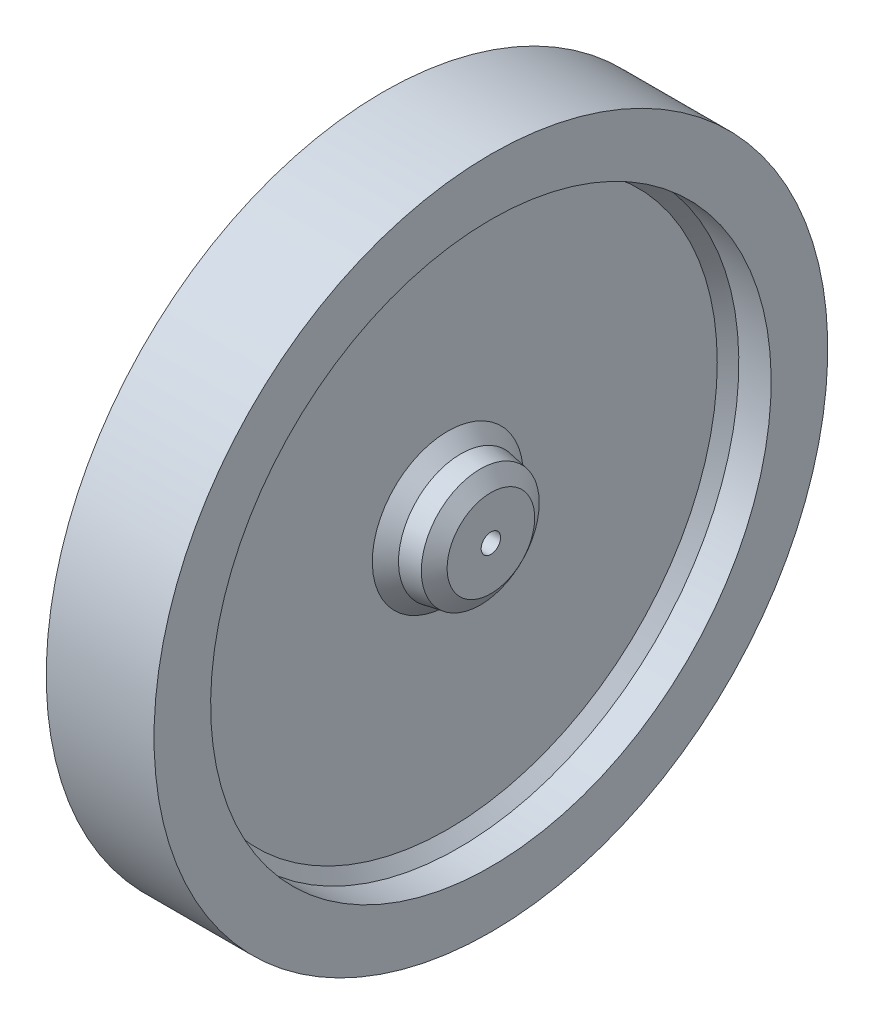
from build123d import *

# Parameters (mm, degrees)
SKETCH1_W           = 10
SKETCH1_H           = 31.25
SKETCH2_R           = 26
CUT_EXTRUDE1_DEPTH  = 4
SKETCH3_R           = 6
BOSS_EXTRUDE1_DEPTH = 4
BOSS_EXTRUDE1_TAPER = 10
CUT_EXTRUDE2_START  = -4
SKETCH4_R           = 26
CUT_EXTRUDE2_DEPTH  = 4
SKETCH5_R           = 6
BOSS_EXTRUDE2_DEPTH = 4
BOSS_EXTRUDE2_TAPER = 10
CHAMFER1_SIZE       = 1
CHAMFER1_SIZE_2     = 1.232803052
SKETCH6_R           = 0.9
CUT_EXTRUDE3_DEPTH  = 46.311422401


with BuildPart() as part:
    # Sketch1 → Revolve1 (revolve)
    with BuildSketch(Plane.XY):
        with Locations((0, -15.625)):
            Rectangle(SKETCH1_W, SKETCH1_H)
    revolve(axis=Axis((-5, 0, 0), (1, 0, 0)))

    # Sketch2 → Cut-Extrude1 (cut)
    with BuildSketch(Plane(origin=(5, 0, 0), x_dir=(0, 0, -1), z_dir=(1, 0, 0))):
        with Locations(Location((0, 0, 0), (0, 0, 90))):
            Circle(SKETCH2_R)
    extrude(amount=-CUT_EXTRUDE1_DEPTH, mode=Mode.SUBTRACT)

    # Sketch3 → Boss-Extrude1 (add)
    with BuildSketch(Plane(origin=(1, 0, 0), x_dir=(0, 0, -1), z_dir=(1, 0, 0))):
        Circle(SKETCH3_R)
    extrude(amount=BOSS_EXTRUDE1_DEPTH, taper=BOSS_EXTRUDE1_TAPER)

    # Sketch4 → Cut-Extrude2 (cut)
    with BuildSketch(Plane.ZY.offset(5).offset(CUT_EXTRUDE2_START)):
        with Locations(Location((0, 0, 0), (0, 0, 90))):
            Circle(SKETCH4_R)
    extrude(amount=CUT_EXTRUDE2_DEPTH, mode=Mode.SUBTRACT)

    # Sketch5 → Boss-Extrude2 (add)
    with BuildSketch(Plane.ZY.offset(1)):
        Circle(SKETCH5_R)
    extrude(amount=BOSS_EXTRUDE2_DEPTH, taper=BOSS_EXTRUDE2_TAPER)

    # Chamfer1
    # the kernel refuses this chamfer: 1.232803052, 1 mm, written as the material it adds along each edge
    with BuildSketch(Plane(origin=(1, 0, 0), x_dir=(0, 0, -1), z_dir=(0, -1, 0))) as chamfer1_piece_1:
        Polygon((6 + CHAMFER1_SIZE, 0), (6 - CHAMFER1_SIZE_2 * 0.173648177642, CHAMFER1_SIZE_2 * 0.98480775287), (6, 0), align=None)
    revolve(axis=Axis((1, 0, 0), (1, 0, 0)))
    with BuildSketch(Plane(origin=(-1, 0, 0), x_dir=(0, 1, 0), z_dir=(0, 0, 1))) as chamfer1_piece_2:
        Polygon((26, CHAMFER1_SIZE), (26 - CHAMFER1_SIZE, 0), (26, 0), align=None)
    revolve(axis=Axis((-1, 0, 0), (-1, 0, 0)))
    with BuildSketch(Plane(origin=(1, 0, 0), x_dir=(0, 1, 0), z_dir=(0, 0, -1))) as chamfer1_piece_3:
        Polygon((26, CHAMFER1_SIZE), (26 - CHAMFER1_SIZE, 0), (26, 0), align=None)
    revolve(axis=Axis((1, 0, 0), (1, 0, 0)))
    with BuildSketch(Plane(origin=(-1, 0, 0), x_dir=(0, 0, 1), z_dir=(0, -1, 0))) as chamfer1_piece_4:
        Polygon((6 + CHAMFER1_SIZE, 0), (6 - CHAMFER1_SIZE_2 * 0.173648177642, CHAMFER1_SIZE_2 * 0.98480775287), (6, 0), align=None)
    revolve(axis=Axis((-1, 0, 0), (-1, 0, 0)))
    # the kernel refuses this chamfer: 1.232803052, 1 mm, written as the material it takes off along each edge
    with BuildSketch(Plane(origin=(5, 0, 0), x_dir=(0, 0, -1), z_dir=(0, 1, 0))) as chamfer1_2_piece_1:
        Polygon((5.294692077 + CHAMFER1_SIZE * 0.173648177667, CHAMFER1_SIZE * 0.984807753012), (5.294692077 - CHAMFER1_SIZE_2, 0), (5.294692077, 0), align=None)
    revolve(axis=Axis((5, 0, 0), (-1, 0, 0)), mode=Mode.SUBTRACT)
    with BuildSketch(Plane(origin=(-5, 0, 0), x_dir=(0, 0, 1), z_dir=(0, 1, 0))) as chamfer1_2_piece_2:
        Polygon((5.294692077 + CHAMFER1_SIZE * 0.173648177667, CHAMFER1_SIZE * 0.984807753012), (5.294692077 - CHAMFER1_SIZE_2, 0), (5.294692077, 0), align=None)
    revolve(axis=Axis((-5, 0, 0), (1, 0, 0)), mode=Mode.SUBTRACT)

    # Sketch6 → Cut-Extrude3 (cut, through all)
    with BuildSketch(Plane.ZY.offset(5)):
        with Locations(Location((0, 0, 0), (0, 0, 270))):
            Circle(SKETCH6_R)
    extrude(amount=-CUT_EXTRUDE3_DEPTH, mode=Mode.SUBTRACT)


solid = part.part
